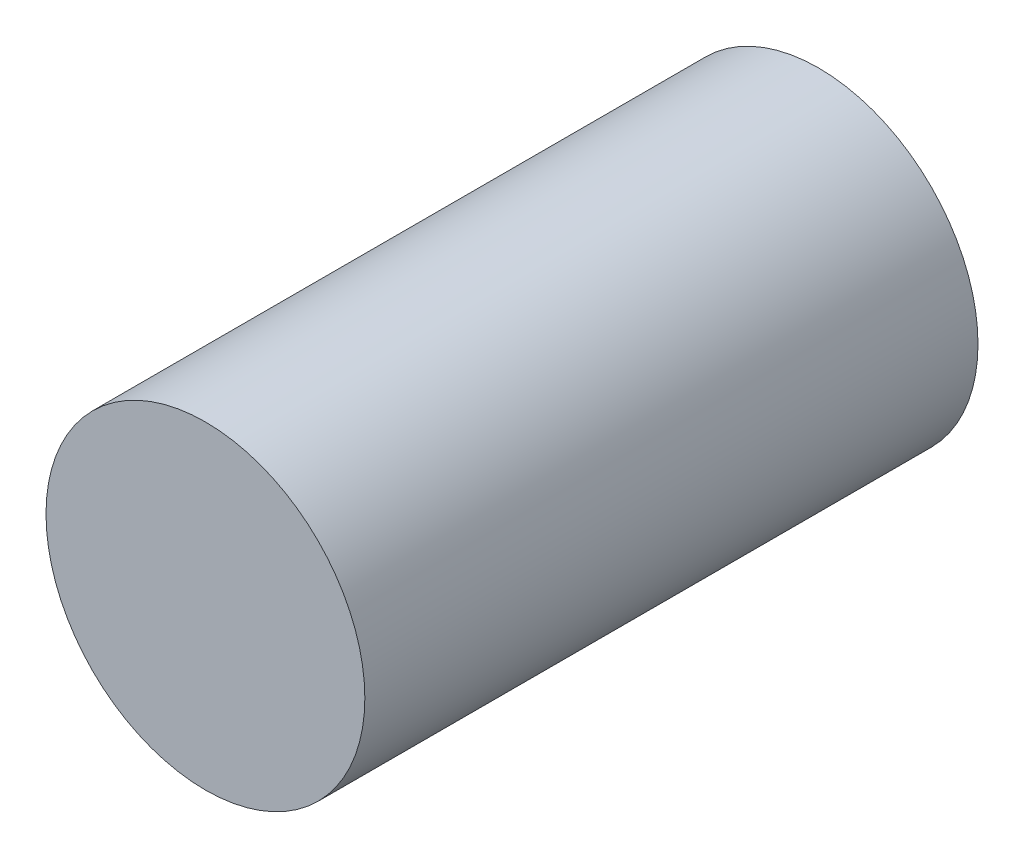
from build123d import *

# Parameters (mm, degrees)
ESQUISSE1_R        = 13
BOSS_EXTRU_1_DEPTH = 50


with BuildPart() as part:
    # Esquisse1 → Boss.-Extru.1 (new body)
    with BuildSketch(Plane.XY):
        Circle(ESQUISSE1_R)
    extrude(amount=-BOSS_EXTRU_1_DEPTH)


solid = part.part
